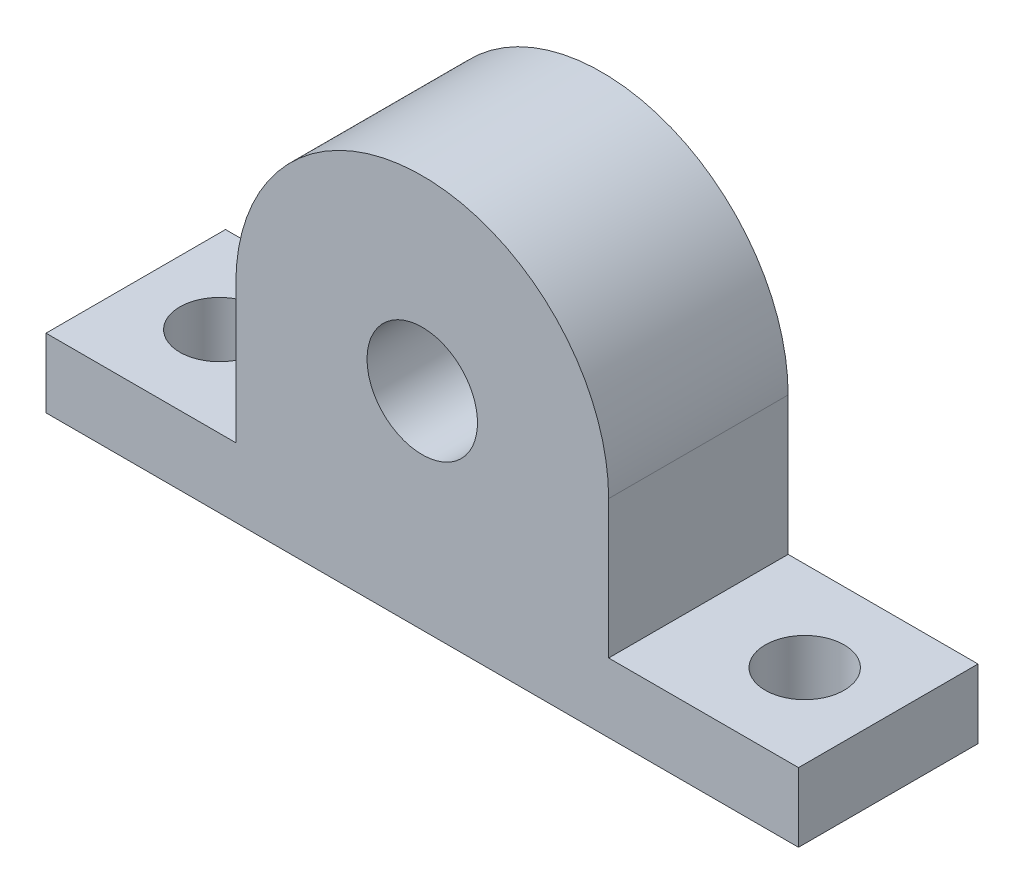
from build123d import *

# Parameters (mm, degrees)
SKETCH1_R           = 4
BOSS_EXTRUDE1_DEPTH = 13
SKETCH2_R           = 2.853745902
CUT_EXTRUDE1_DEPTH  = 13


with BuildPart() as part:
    # Sketch1 → Boss-Extrude1 (new body)
    with BuildSketch(Plane.XY):
        with BuildLine():
            Line((0, 0), (54.5, 0))
            Line((54.5, 0), (54.5, 5))
            Line((54.5, 5), (40.75, 5))
            Line((40.75, 5), (40.75, 15))
            ThreePointArc((40.75, 15), (27.25, 28.5), (13.75, 15))
            Line((13.75, 15), (13.75, 5))
            Line((13.75, 5), (0, 5))
            Line((0, 5), (0, 0))
        make_face()
        with Locations((27.25, 15)):
            Circle(SKETCH1_R, mode=Mode.SUBTRACT)
    extrude(amount=BOSS_EXTRUDE1_DEPTH)

    # Sketch2 → Cut-Extrude1 (cut)
    with BuildSketch(Plane(origin=(0, 5, 0), x_dir=(1, 0, 0), z_dir=(0, 1, 0))):
        with Locations((48.45, -6.5)):
            Circle(SKETCH2_R)
        with Locations((6.05, -6.5)):
            Circle(SKETCH2_R)
    extrude(amount=-CUT_EXTRUDE1_DEPTH, mode=Mode.SUBTRACT)


solid = part.part
